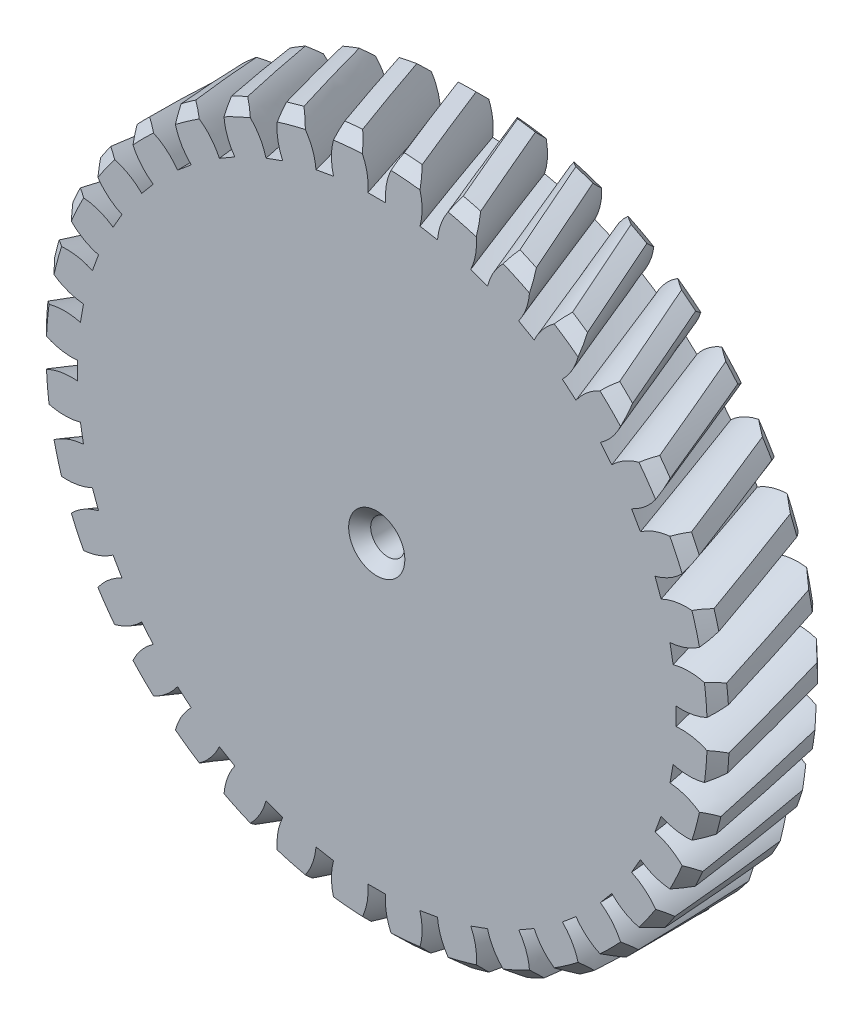
from build123d import *

# Parameters (mm, degrees)
SKETCH5_R           = 31
SKETCH5_R_2         = 1.55
BOSS_EXTRUDE1_DEPTH = 10
CUT_EXTRUDE1_DEPTH  = 3
FILLET1_R           = 1
CHAMFER1_SIZE       = 1
CUT_SWEEP1_PITCH    = 500
CIRPATTERN1_COUNT   = 36


with BuildPart() as part:
    # Sketch5 → Boss-Extrude1 (new body)
    with BuildSketch(Plane(origin=(0, 0, 0), x_dir=(0, 1, 0), z_dir=(0, 0, 1))):
        with Locations(Location((0, 0, 0), (0, 0, 270))):
            Circle(SKETCH5_R)
        with Locations(Location((0, 0, 0), (0, 0, 270))):
            Circle(SKETCH5_R_2, mode=Mode.SUBTRACT)
    extrude(amount=BOSS_EXTRUDE1_DEPTH)

    # Sketch3 → Cut-Extrude1 (cut)
    with BuildSketch(Plane(origin=(0, 0, 0), x_dir=(0, 1, 0), z_dir=(0, 0, 1))):
        with BuildLine():
            Line((-3.692642461, 6.395844357), (-2.466521541, 13.812520629))
            ThreePointArc((-2.466521541, 13.812520629), (0, 15.904756618), (2.466521541, 13.812520629))
            Line((2.466521541, 13.812520629), (3.692642461, 6.395844357))
            Line((3.692642461, 6.395844357), (10.728732985, 9.042330628))
            ThreePointArc((10.728732985, 9.042330628), (13.773923273, 7.952378309), (13.195254525, 4.770190001))
            Line((13.195254525, 4.770190001), (7.385284922, 0))
            Line((7.385284922, 0), (13.195254525, -4.770190001))
            ThreePointArc((13.195254525, -4.770190001), (13.773923273, -7.952378309), (10.728732985, -9.042330628))
            Line((10.728732985, -9.042330628), (3.692642461, -6.395844357))
            Line((3.692642461, -6.395844357), (2.466521541, -13.812520629))
            ThreePointArc((2.466521541, -13.812520629), (0, -15.904756618), (-2.466521541, -13.812520629))
            Line((-2.466521541, -13.812520629), (-3.692642461, -6.395844357))
            Line((-3.692642461, -6.395844357), (-10.728732985, -9.042330628))
            ThreePointArc((-10.728732985, -9.042330628), (-13.773923273, -7.952378309), (-13.195254525, -4.770190001))
            Line((-13.195254525, -4.770190001), (-7.385284922, 0))
            Line((-7.385284922, 0), (-13.195254525, 4.770190001))
            ThreePointArc((-13.195254525, 4.770190001), (-13.773923273, 7.952378309), (-10.728732985, 9.042330628))
            Line((-10.728732985, 9.042330628), (-3.692642461, 6.395844357))
        make_face()
    extrude(amount=CUT_EXTRUDE1_DEPTH, mode=Mode.SUBTRACT)

    # Fillet1
    fillet1_edges = [part.edges().sort_by_distance(p)[0] for p in [
        (-15.904756618, 0, 0),
        (-10.104182493, -3.079582001, 0),
        (-7.719087492, -7.210687723, 0),
        (-7.952378309, -13.773923273, 0),
        (-2.385095001, -10.290269724, 0),
        (2.385095001, -10.290269724, 0),
        (7.952378309, -13.773923273, 0),
        (7.719087492, -7.210687723, 0),
        (10.104182493, -3.079582001, 0),
        (15.904756618, 0, 0),
        (10.104182493, 3.079582001, 0),
        (7.719087492, 7.210687723, 0),
        (7.952378309, 13.773923273, 0),
        (2.385095001, 10.290269724, 0),
        (-2.385095001, 10.290269724, 0),
        (-7.952378309, 13.773923273, 0),
        (-7.719087492, 7.210687723, 0),
        (-10.104182493, 3.079582001, 0),
    ]]
    fillet(fillet1_edges, radius=FILLET1_R)

    # Chamfer1
    chamfer1_edges = [part.edges().sort_by_distance(p)[0] for p in [
        (-31, 0, 0),
        (-31, 0, 10),
        (-1.55, 0, 10),
    ]]
    chamfer(chamfer1_edges, length=CHAMFER1_SIZE)

    # Cut-Sweep1: the profile of Sketch10 screwed along a left-hand helix of 0.04 turns, 58 arcs to a turn; built about Z, then put on its axis
    cut_sweep1_z = Axis((0, 0, 0), (0, 0, 1))
    cut_sweep1_corners = [(-27.169545431, 0.8085, 0), (-27.169545431, -0.8085, 0), (-30.942545431, -1.8865, 0), (-30.942545431, 1.8865, 0)]
    with BuildLine(mode=Mode.PRIVATE) as cut_sweep1_profile:
        Line(cut_sweep1_corners[0], cut_sweep1_corners[1])
        ThreePointArc((-27.169545431, -0.8085, 0), (-29.157629405, -0.991956093, 0), (-30.942545431, -1.8865, 0))
        ThreePointArc((-30.942545431, -1.8865, 0), (-31, 0, 0), (-30.942545431, 1.8865, 0))
        ThreePointArc((-30.942545431, 1.8865, 0), (-29.157629405, 0.991956093, 0), (-27.169545431, 0.8085, 0))
    cut_sweep1_cap = Face(cut_sweep1_profile.wire())
    cut_sweep1_arcs = [((-27.169545431, -0.8085, 0), (-29.266695673, -0.610224153, 0), (-30.942545431, -1.8865, 0), (1, 0.9313968005098576, 1)), ((-30.942545431, -1.8865, 0), (-31.057561251, 0, 0), (-30.942545431, 1.8865, 0), (1, 0.9981466268067127, 1)), ((-30.942545431, 1.8865, 0), (-29.266695673, 0.610224153, 0), (-27.169545431, 0.8085, 0), (1, 0.9313968005098574, 1))]  # start, shoulder, end, weights
    cut_sweep1_turn_angles = [0, -3.103448276, -6.206896552, -9.310344828, -12.413793103, -13.406896552, -14.4]
    cut_sweep1_turn_weights = [1, 0.9985334138511238, 1, 0.9985334138511238, 1, 0.9998497886164538, 1]
    cut_sweep1_turn_rails = [Edge.make_bspline([Vector(p[0], p[1], 0).rotate(cut_sweep1_z, cut_sweep1_turn_angles[k]) / cut_sweep1_turn_weights[k] + Vector(0, 0, p[2] + -CUT_SWEEP1_PITCH * cut_sweep1_turn_angles[k] / 360) for k in range(7)], [0, 0, 0, 1, 1, 2, 2, 3, 3, 3], 2, cut_sweep1_turn_weights) for p in cut_sweep1_corners]
    cut_sweep1_turn_sides = [*[Face.make_surface_from_curves(cut_sweep1_turn_rails[p[0]], cut_sweep1_turn_rails[p[1]]) for p in [(0, 1)]], *[Face.make_bezier_surface([[Vector(p[j][0], p[j][1], 0).rotate(cut_sweep1_z, cut_sweep1_turn_angles[2 * i + k]) / cut_sweep1_turn_weights[2 * i + k] + Vector(0, 0, p[j][2] + -CUT_SWEEP1_PITCH * cut_sweep1_turn_angles[2 * i + k] / 360) for k in range(3)] for j in range(3)], [[p[3][j] * cut_sweep1_turn_weights[2 * i + k] for k in range(3)] for j in range(3)]) for p in cut_sweep1_arcs for i in range(3)]]
    cut_sweep1 = Plane(origin=(0, 0, 10), x_dir=(-1, 0, 0), z_dir=(0, 0, -1)) * Solid(Shell([*cut_sweep1_turn_sides, cut_sweep1_cap, cut_sweep1_cap.rotate(cut_sweep1_z, -14.4).moved(Location((0, 0, -CUT_SWEEP1_PITCH * -14.4 / 360)))]))
    add(cut_sweep1, mode=Mode.SUBTRACT)

    # CirPattern1: Cut-Sweep1 ×36 about axis
    cirpattern1_axis = Axis((0, 0, 10), (0, 0, -1))
    for i in range(1, CIRPATTERN1_COUNT):
        add(cut_sweep1.rotate(cirpattern1_axis, i * 360 / CIRPATTERN1_COUNT), mode=Mode.SUBTRACT)


solid = part.part
